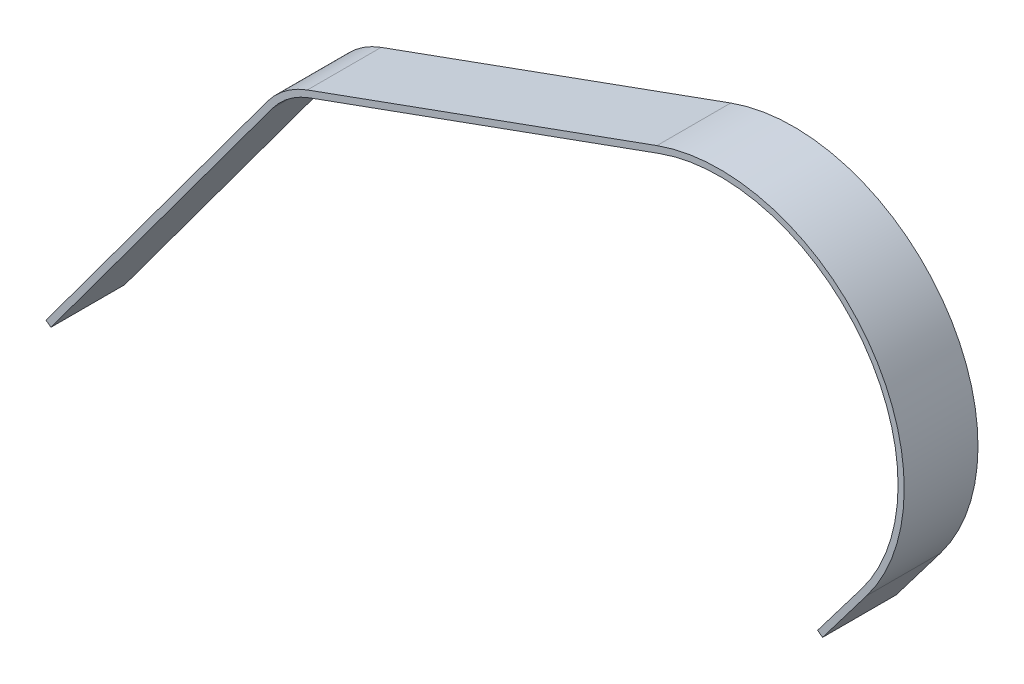
from build123d import *

# Parameters (mm, degrees)
EXTRUDE_THIN1_DEPTH = 38.1


with BuildPart() as part:
    # Sketch1 → Extrude-Thin1 (new body)
    with BuildSketch(Plane.XY):
        with BuildLine():
            Line((-171.530725158, -169.540176263), (-57.207776809, -14.493356815))
            ThreePointArc((-57.207776809, -14.493356815), (-48.029088686, -5.258412911), (-36.568222458, 0.920668726))
            Line((-36.568222458, 0.920668726), (143.952557391, 66.301099815))
            ThreePointArc((143.952557391, 66.301099815), (253.095507904, 33.210999285), (252.264699452, -80.834816757))
            Line((252.264699452, -80.834816757), (229.469051384, -110.874685447))
            Line((229.469051384, -110.874685447), (226.93983158, -108.955395947))
            Line((226.93983158, -108.955395947), (249.735479648, -78.915527258))
            ThreePointArc((249.735479648, -78.915527258), (250.538594484, 31.328761583), (145.033742323, 63.315858762))
            Line((145.033742323, 63.315858762), (-35.487037526, -2.064572327))
            ThreePointArc((-35.487037526, -2.064572327), (-46.129270453, -7.80229099), (-54.652337995, -16.377596044))
            Line((-54.652337995, -16.377596044), (-168.975286345, -171.424415492))
            Line((-168.975286345, -171.424415492), (-171.530725158, -169.540176263))
        make_face()
    extrude(amount=EXTRUDE_THIN1_DEPTH)


solid = part.part
